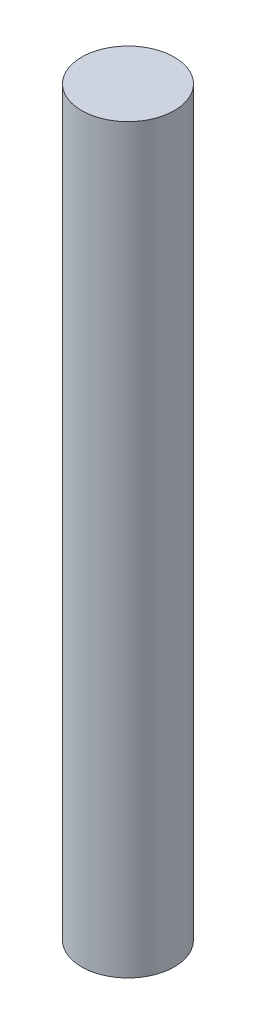
from build123d import *

# Parameters (mm, degrees)
SKETCH1_R           = 9.525
BOSS_EXTRUDE1_DEPTH = 152.4


with BuildPart() as part:
    # Sketch1 → Boss-Extrude1 (new body)
    with BuildSketch(Plane(origin=(0, 0, 0), x_dir=(1, 0, 0), z_dir=(0, 1, 0))):
        Circle(SKETCH1_R)
    extrude(amount=-BOSS_EXTRUDE1_DEPTH)


solid = part.part
